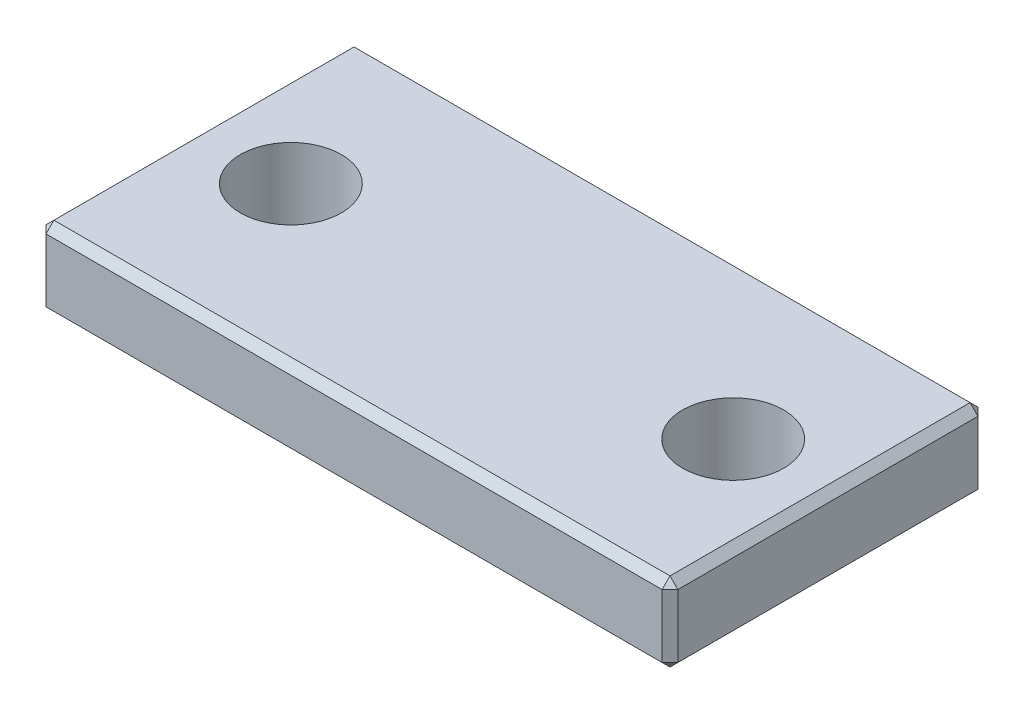
from build123d import *

# Parameters (mm, degrees)
SKETCH1_W            = 40
SKETCH1_H            = 20
BOSS_EXTRUDE1_DEPTH  = 5
M6_CLEARANCE_HOLE1_D = 6.4
CHAMFER1_SIZE        = 0.5


with BuildPart() as part:
    # Sketch1 → Boss-Extrude1 (new body)
    with BuildSketch(Plane(origin=(0, 0, 0), x_dir=(1, 0, 0), z_dir=(0, 1, 0))):
        Rectangle(SKETCH1_W, SKETCH1_H)
    extrude(amount=BOSS_EXTRUDE1_DEPTH)

    # M6 Clearance Hole1 (through all)
    with Locations(Plane(origin=(0, 5, 0), x_dir=(1, 0, 0), z_dir=(0, 1, 0))):
        with Locations((-14, 0), (14, 0)):
            Hole(M6_CLEARANCE_HOLE1_D / 2)

    # Chamfer1
    chamfer1_edges = [part.edges().sort_by_distance(p)[0] for p in [
        (0, 0, -10),
        (-20, 2.5, -10),
        (-20, 2.5, 10),
        (-20, 5, 0),
        (-20, 0, 0),
        (20, 2.5, -10),
        (20, 0, 0),
        (0, 0, 10),
        (20, 2.5, 10),
        (0, 5, -10),
        (20, 5, 0),
        (0, 5, 10),
    ]]
    chamfer(chamfer1_edges, length=CHAMFER1_SIZE)


solid = part.part
